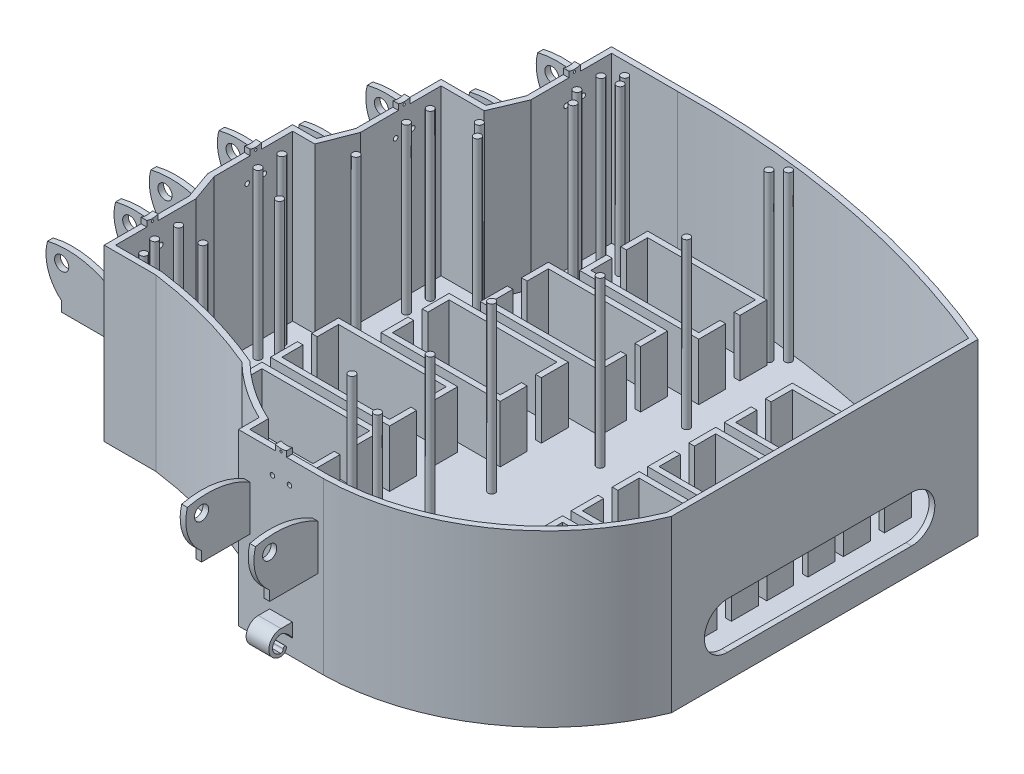
from build123d import *

# Parameters (mm, degrees)
BOSS_EXTRUDE1_DEPTH                = 38.1
CUT_EXTRUDE1_DEPTH                 = 36.83
BOSS_EXTRUDE2_DEPTH                = 13.97
BOSS_EXTRUDE3_DEPTH                = 13.97
BOSS_EXTRUDE4_DEPTH                = 13.97
BOSS_EXTRUDE5_DEPTH                = 13.97
BOSS_EXTRUDE6_DEPTH                = 13.97
BOSS_EXTRUDE7_DEPTH                = 13.97
BOSS_EXTRUDE8_DEPTH                = 13.97
BOSS_EXTRUDE9_DEPTH                = 13.97
BOSS_EXTRUDE10_DEPTH               = 13.97
BOSS_EXTRUDE11_DEPTH               = 13.97
SKETCH25_R                         = 0.508
THUMB_HOLES_DEPTH                  = 12.7
SKETCH31_R                         = 0.508
INDEX_FINGER_HOLES_DEPTH           = 17.018
SKETCH32_R                         = 0.508
MIDDLE_FINGER_HOLES_DEPTH          = 15.24
SKETCH33_R                         = 0.508
RING_FINGER_HOLES_DEPTH            = 22.86
SKETCH34_R                         = 0.508
PINKY_FINGER_HOLES_DEPTH           = 35.56
SKETCH26_R                         = 0.79375
GUIDE_POLES_DEPTH                  = 36.83
SKETCH35_R                         = 1.5875
PINKY_ATTACHMENT_DEPTH             = 19.05
SKETCH36_R                         = 1.5875
RING_ATTACHMENT_DEPTH              = 19.05
SKETCH37_R                         = 1.5875
MIDDLE_ATTACHMENT_DEPTH            = 19.05
SKETCH38_R                         = 1.5875
POINTER_ATTACHMENT_DEPTH           = 19.05
SKETCH39_R                         = 1.5875
THUMB_ATTACHMENT_DEPTH             = 19.05
ATTACHMENT_TRIM_DEPTH              = 25.4
CORD_HOLE_DEPTH                    = 5.08
SKETCH42_W                         = 1.27
SKETCH42_H                         = 2.54
SKETCH42_W_2                       = 2.54
SKETCH42_H_2                       = 1.27
LINE_CONNECTORS_ON_HAND_EDGE_DEPTH = 1.27
SKETCH43_R                         = 0.254
FINGER_LINE_CONNECTOR_CUT_DEPTH    = 50.8
SKETCH44_R                         = 0.254
THUMB_LINE_CONNECTOR_CUT_DEPTH     = 12.7
PINKY_HOOK_DEPTH                   = 19.05
SKETCH47_W                         = 5.527423295
SKETCH47_H                         = 7.099733724
PINKY_HOOK_CUT_1_DEPTH             = 19.05
RING_HOOK_DEPTH                    = 19.05
SKETCH53_W                         = 5.632789883
SKETCH53_H                         = 7.123488913
RING_HOOK_CUT_1_DEPTH              = 19.05
MIDDLE_HOOK_DEPTH                  = 19.05
MIDDLE_HOOK_2_DEPTH                = 19.05
SKETCH57_W                         = 6.44385504
SKETCH57_H                         = 7.30367128
MIDDLE_HOOK_CUT_1_DEPTH            = 19.05
POINTER_HOOK_DEPTH                 = 19.05
SKETCH60_W                         = 5.76253221
SKETCH60_H                         = 6.997945427
POINTER_HOOK_CUT_1_DEPTH           = 19.05
THUMB_HOOK_DEPTH                   = 19.05
SKETCH64_W                         = 5.967890502
SKETCH64_H                         = 7.075125102
THUMB_HOOK_CUT_1_DEPTH             = 19.05
SKETCH65_W                         = 7.179265415
SKETCH65_H                         = 6.121930472
SKETCH65_W_2                       = 6.985
SKETCH65_H_2                       = 5.903479726
SKETCH65_W_3                       = 5.256802475
SKETCH65_H_3                       = 6.985
SKETCH65_W_4                       = 5.256802476
SKETCH65_W_5                       = 5.561170092
CUT_EXTRUDE9_DEPTH                 = 13.97


with BuildPart() as part:
    # Sketch2 → Boss-Extrude1 (new body)
    with BuildSketch(Plane(origin=(0, 0, 0), x_dir=(1, 0, 0), z_dir=(0, 1, 0))):
        with BuildLine():
            Line((-20.778406205, 52.758673202), (-36.188953289, 52.758673202))
            Line((-36.188953289, 52.758673202), (-36.188953289, 33.708673202))
            Line((-36.188953289, 33.708673202), (-38.864171838, 27.358673202))
            Line((-38.864171838, 27.358673202), (-48.947687906, 27.358673202))
            Line((-48.947687906, 27.358673202), (-48.947687906, 8.308673202))
            Line((-48.947687906, 8.308673202), (-51.417120413, 1.958673202))
            Line((-51.417120413, 1.958673202), (-56.767557511, 1.958673202))
            Line((-56.767557511, 1.958673202), (-56.767557511, -17.091326798))
            Line((-56.767557511, -17.091326798), (-54.503911047, -23.441326798))
            Line((-54.503911047, -23.441326798), (-54.503911047, -42.491326798))
            Line((-54.503911047, -42.491326798), (-42.959403849, -42.491326798))
            ThreePointArc((-42.959403849, -42.491326798), (-29.448791922, -45.239401215), (-16.422067996, -49.755263412))
            ThreePointArc((-16.422067996, -49.755263412), (-10.441569813, -54.6928899), (-3.738179712, -58.593027718))
            Line((-3.738179712, -58.593027718), (-3.738179712, -63.210333869))
            Line((-3.738179712, -63.210333869), (15.311820288, -63.210333869))
            ThreePointArc((15.311820288, -63.210333869), (43.202331698, -54.363191859), (61.572422141, -31.588374066))
            Line((61.572422141, -31.588374066), (61.572422141, 37.055318004))
            ThreePointArc((61.572422141, 37.055318004), (21.220515188, 49.225595088), (-20.778406205, 52.758673202))
        make_face()
    extrude(amount=BOSS_EXTRUDE1_DEPTH)

    # Sketch3 → Cut-Extrude1 (cut)
    with BuildSketch(Plane(origin=(0, 38.1, 0), x_dir=(1, 0, 0), z_dir=(0, 1, 0))):
        with BuildLine():
            Line((-20.193208334, 51.499667825), (-34.918953289, 51.499667825))
            Line((-34.918953289, 51.499667825), (-34.918953289, 33.452072477))
            Line((-34.918953289, 33.452072477), (-38.021111135, 26.088673202))
            Line((-38.021111135, 26.088673202), (-47.677687906, 26.088673202))
            Line((-47.677687906, 26.088673202), (-47.677687906, 8.070420839))
            Line((-47.677687906, 8.070420839), (-50.548353666, 0.688673202))
            Line((-50.548353666, 0.688673202), (-55.497557511, 0.688673202))
            Line((-55.497557511, 0.688673202), (-55.497557511, -16.871730038))
            Line((-55.497557511, -16.871730038), (-53.233911047, -23.221730038))
            Line((-53.233911047, -23.221730038), (-53.233911047, -41.221326798))
            Line((-53.233911047, -41.221326798), (-42.874353316, -41.221326798))
            ThreePointArc((-42.874353316, -41.221326798), (-29.038510393, -44.035017068), (-15.705342229, -48.67980221))
            ThreePointArc((-15.705342229, -48.67980221), (-9.484723257, -53.810670952), (-2.468179712, -57.784338167))
            Line((-2.468179712, -57.784338167), (-2.468179712, -61.940333869))
            Line((-2.468179712, -61.940333869), (15.331165443, -61.940333869))
            ThreePointArc((15.331165443, -61.940333869), (42.399187632, -53.3742297), (60.302422141, -31.339480781))
            Line((60.302422141, -31.339480781), (60.302422141, 36.20914612))
            ThreePointArc((60.302422141, 36.20914612), (20.842965823, 48.004654395), (-20.193208334, 51.499667825))
        make_face()
    extrude(amount=-CUT_EXTRUDE1_DEPTH, mode=Mode.SUBTRACT)

    # Sketch6 → Boss-Extrude2 (add)
    with BuildSketch(Plane(origin=(0, 0, 0), x_dir=(1, 0, 0), z_dir=(0, 1, 0))):
        Polygon((-38.295888343, -32.597001669), (-37.025888343, -32.597001669), (-37.025888343, -37.359501669), (-12.895888343, -37.359501669), (-12.895888343, -32.597001669), (-11.625888343, -32.597001669), (-11.625888343, -38.629501669), (-38.295888343, -38.629501669), align=None)
        Polygon((-12.895888343, -24.659501669), (-37.025888343, -24.659501669), (-37.025888343, -29.422001669), (-38.295888343, -29.422001669), (-38.295888343, -23.389501669), (-11.625888343, -23.389501669), (-11.625888343, -29.422001669), (-12.895888343, -29.422001669), align=None)
    extrude(amount=BOSS_EXTRUDE2_DEPTH)

    # Sketch7 → Boss-Extrude3 (add)
    with BuildSketch(Plane(origin=(0, 0, 0), x_dir=(1, 0, 0), z_dir=(0, 1, 0))):
        Polygon((-38.295888343, -15.452001669), (-37.025888343, -15.452001669), (-37.025888343, -20.214501669), (-12.895888343, -20.214501669), (-12.895888343, -15.452001669), (-11.625888343, -15.452001669), (-11.625888343, -21.484501669), (-38.295888343, -21.484501669), align=None)
        Polygon((-12.895888343, -7.514501669), (-37.025888343, -7.514501669), (-37.025888343, -12.277001669), (-38.295888343, -12.277001669), (-38.295888343, -6.244501669), (-11.625888343, -6.244501669), (-11.625888343, -12.277001669), (-12.895888343, -12.277001669), align=None)
    extrude(amount=BOSS_EXTRUDE3_DEPTH)

    # Sketch15 → Boss-Extrude4 (add)
    with BuildSketch(Plane.XZ):
        Polygon((-30.675888343, -4.867998331), (-29.405888343, -4.867998331), (-29.405888343, -9.630498331), (-5.275888343, -9.630498331), (-5.275888343, -4.867998331), (-4.005888343, -4.867998331), (-4.005888343, -10.900498331), (-30.675888343, -10.900498331), align=None)
        Polygon((-5.275888343, 3.069501669), (-29.405888343, 3.069501669), (-29.405888343, -1.692998331), (-30.675888343, -1.692998331), (-30.675888343, 4.339501669), (-4.005888343, 4.339501669), (-4.005888343, -1.692998331), (-5.275888343, -1.692998331), align=None)
    extrude(amount=-BOSS_EXTRUDE4_DEPTH)

    # Sketch16 → Boss-Extrude5 (add)
    with BuildSketch(Plane.XZ):
        Polygon((-25.595888343, -22.012998331), (-24.325888343, -22.012998331), (-24.325888343, -26.775498331), (-0.195888343, -26.775498331), (-0.195888343, -22.012998331), (1.074111657, -22.012998331), (1.074111657, -28.045498331), (-25.595888343, -28.045498331), align=None)
        Polygon((-0.195888343, -14.075498331), (-24.325888343, -14.075498331), (-24.325888343, -18.837998331), (-25.595888343, -18.837998331), (-25.595888343, -12.805498331), (1.074111657, -12.805498331), (1.074111657, -18.837998331), (-0.195888343, -18.837998331), align=None)
    extrude(amount=-BOSS_EXTRUDE5_DEPTH)

    # Sketch17 → Boss-Extrude6 (add)
    with BuildSketch(Plane.XZ):
        Polygon((-20.515888343, -39.157998331), (-19.245888343, -39.157998331), (-19.245888343, -43.920498331), (4.884111657, -43.920498331), (4.884111657, -39.157998331), (6.154111657, -39.157998331), (6.154111657, -45.190498331), (-20.515888343, -45.190498331), align=None)
        Polygon((4.884111657, -31.220498331), (-19.245888343, -31.220498331), (-19.245888343, -35.982998331), (-20.515888343, -35.982998331), (-20.515888343, -29.950498331), (6.154111657, -29.950498331), (6.154111657, -35.982998331), (4.884111657, -35.982998331), align=None)
    extrude(amount=-BOSS_EXTRUDE6_DEPTH)

    # Sketch18 → Boss-Extrude7 (add)
    with BuildSketch(Plane.XZ):
        Polygon((14.980982224, 42.694916505), (16.250982224, 42.694916505), (16.250982224, 37.932416505), (40.380982224, 37.932416505), (40.380982224, 42.694916505), (41.650982224, 42.694916505), (41.650982224, 36.662416505), (14.980982224, 36.662416505), align=None)
        Polygon((40.380982224, 50.632416505), (16.250982224, 50.632416505), (16.250982224, 45.869916505), (14.980982224, 45.869916505), (14.980982224, 51.902416505), (41.650982224, 51.902416505), (41.650982224, 45.869916505), (40.380982224, 45.869916505), align=None)
    extrude(amount=-BOSS_EXTRUDE7_DEPTH)

    # Sketch19 → Boss-Extrude8 (add)
    with BuildSketch(Plane.XZ):
        Polygon((25.140982224, 25.549916505), (26.410982224, 25.549916505), (26.410982224, 20.787416505), (50.540982224, 20.787416505), (50.540982224, 25.549916505), (51.810982224, 25.549916505), (51.810982224, 19.517416505), (25.140982224, 19.517416505), align=None)
        Polygon((50.540982224, 33.487416505), (26.410982224, 33.487416505), (26.410982224, 28.724916505), (25.140982224, 28.724916505), (25.140982224, 34.757416505), (51.810982224, 34.757416505), (51.810982224, 28.724916505), (50.540982224, 28.724916505), align=None)
    extrude(amount=-BOSS_EXTRUDE8_DEPTH)

    # Sketch20 → Boss-Extrude9 (add)
    with BuildSketch(Plane.XZ):
        Polygon((25.140982224, 8.404916505), (26.410982224, 8.404916505), (26.410982224, 3.642416505), (50.540982224, 3.642416505), (50.540982224, 8.404916505), (51.810982224, 8.404916505), (51.810982224, 2.372416505), (25.140982224, 2.372416505), align=None)
        Polygon((50.540982224, 16.342416505), (26.410982224, 16.342416505), (26.410982224, 11.579916505), (25.140982224, 11.579916505), (25.140982224, 17.612416505), (51.810982224, 17.612416505), (51.810982224, 11.579916505), (50.540982224, 11.579916505), align=None)
    extrude(amount=-BOSS_EXTRUDE9_DEPTH)

    # Sketch21 → Boss-Extrude10 (add)
    with BuildSketch(Plane.XZ):
        Polygon((25.140982224, -8.740083495), (26.410982224, -8.740083495), (26.410982224, -13.502583495), (50.540982224, -13.502583495), (50.540982224, -8.740083495), (51.810982224, -8.740083495), (51.810982224, -14.772583495), (25.140982224, -14.772583495), align=None)
        Polygon((50.540982224, -0.802583495), (26.410982224, -0.802583495), (26.410982224, -5.565083495), (25.140982224, -5.565083495), (25.140982224, 0.467416505), (51.810982224, 0.467416505), (51.810982224, -5.565083495), (50.540982224, -5.565083495), align=None)
    extrude(amount=-BOSS_EXTRUDE10_DEPTH)

    # Sketch22 → Boss-Extrude11 (add)
    with BuildSketch(Plane.XZ):
        Polygon((25.140982224, -25.885083495), (26.410982224, -25.885083495), (26.410982224, -30.647583495), (50.540982224, -30.647583495), (50.540982224, -25.885083495), (51.810982224, -25.885083495), (51.810982224, -31.917583495), (25.140982224, -31.917583495), align=None)
        Polygon((50.540982224, -17.947583495), (26.410982224, -17.947583495), (26.410982224, -22.710083495), (25.140982224, -22.710083495), (25.140982224, -16.677583495), (51.810982224, -16.677583495), (51.810982224, -22.710083495), (50.540982224, -22.710083495), align=None)
    extrude(amount=-BOSS_EXTRUDE11_DEPTH)

    # Sketch25 → Thumb Holes (cut)
    with BuildSketch(Plane.XY.offset(63.5)):
        with Locations((7.691820288, 33.02)):
            Circle(SKETCH25_R)
        with Locations((3.881820288, 33.02)):
            Circle(SKETCH25_R)
    extrude(amount=-THUMB_HOLES_DEPTH, mode=Mode.SUBTRACT)

    # Sketch31 → Index Finger Holes (cut)
    with BuildSketch(Plane(origin=(-69.85, 0, 0), x_dir=(0, 0, -1), z_dir=(1, 0, 0))):
        with Locations((-31.061326798, 33.02)):
            Circle(SKETCH31_R)
        with Locations((-34.871326798, 33.02)):
            Circle(SKETCH31_R)
    extrude(amount=INDEX_FINGER_HOLES_DEPTH, mode=Mode.SUBTRACT)

    # Sketch32 → Middle Finger Holes (cut)
    with BuildSketch(Plane(origin=(-69.85, 0, 0), x_dir=(0, 0, -1), z_dir=(1, 0, 0))):
        with Locations((-9.471326798, 33.02)):
            Circle(SKETCH32_R)
        with Locations((-5.661326798, 33.02)):
            Circle(SKETCH32_R)
    extrude(amount=MIDDLE_FINGER_HOLES_DEPTH, mode=Mode.SUBTRACT)

    # Sketch33 → Ring Finger Holes (cut)
    with BuildSketch(Plane(origin=(-69.85, 0, 0), x_dir=(0, 0, -1), z_dir=(1, 0, 0))):
        with Locations((15.928673202, 33.02)):
            Circle(SKETCH33_R)
        with Locations((19.738673202, 33.02)):
            Circle(SKETCH33_R)
    extrude(amount=RING_FINGER_HOLES_DEPTH, mode=Mode.SUBTRACT)

    # Sketch34 → Pinky Finger Holes (cut)
    with BuildSketch(Plane(origin=(-69.85, 0, 0), x_dir=(0, 0, -1), z_dir=(1, 0, 0))):
        with Locations((41.328673202, 33.02)):
            Circle(SKETCH34_R)
        with Locations((45.181435651, 33.02)):
            Circle(SKETCH34_R)
    extrude(amount=PINKY_FINGER_HOLES_DEPTH, mode=Mode.SUBTRACT)

    # Sketch26 → Guide Poles (add)
    with BuildSketch(Plane(origin=(0, 38.1, 0), x_dir=(1, 0, 0), z_dir=(0, 1, 0))):
        with Locations((8.453820288, -44.282416505)):
            Circle(SKETCH26_R)
        with Locations((3.119820288, -27.137416505)):
            Circle(SKETCH26_R)
        with Locations((-0.26286752, -9.992416505)):
            Circle(SKETCH26_R)
        with Locations((6.891203923, 7.152583495)):
            Circle(SKETCH26_R)
        with Locations((9.098692406, 24.297583495)):
            Circle(SKETCH26_R)
        with Locations((-1.85036752, -39.675840032)):
            Circle(SKETCH26_R)
        with Locations((7.511192406, 48.675794749)):
            Circle(SKETCH26_R)
        with Locations((5.303703923, 46.519643207)):
            Circle(SKETCH26_R)
        with Locations((-48.471411047, -39.675840032)):
            Circle(SKETCH26_R)
        with Locations((-52.322557511, -10.233326798)):
            Circle(SKETCH26_R)
        with Locations((-52.322557511, -4.899326798)):
            Circle(SKETCH26_R)
        with Locations((-43.893096038, -13.864501669)):
            Circle(SKETCH26_R)
        with Locations((-43.893096038, 3.280498331)):
            Circle(SKETCH26_R)
        with Locations((-33.874140009, 20.425498331)):
            Circle(SKETCH26_R)
        with Locations((-44.502687906, 15.166673202)):
            Circle(SKETCH26_R)
        with Locations((-29.603786365, 37.570498331)):
            Circle(SKETCH26_R)
        with Locations((-36.306573109, 23.2953928)):
            Circle(SKETCH26_R)
        with Locations((-44.502687906, 20.500673202)):
            Circle(SKETCH26_R)
        with Locations((-28.009949736, 46.519643207)):
            Circle(SKETCH26_R)
        with Locations((-29.153323684, 48.675794749)):
            Circle(SKETCH26_R)
        with Locations((-31.743953289, 40.566673202)):
            Circle(SKETCH26_R)
        with Locations((-31.743953289, 45.943435651)):
            Circle(SKETCH26_R)
        with Locations((-50.058911047, -35.633326798)):
            Circle(SKETCH26_R)
        with Locations((-50.058911047, -30.299326798)):
            Circle(SKETCH26_R)
        with Locations((-43.893096038, -31.009501669)):
            Circle(SKETCH26_R)
    extrude(amount=-GUIDE_POLES_DEPTH)

    # Sketch35 → Pinky Attachment (add)
    with BuildSketch(Plane(origin=(0, 0, -52.758673202), x_dir=(-1, 0, 0), z_dir=(0, 0, -1))):
        with BuildLine():
            Line((36.188953289, 19.05), (40.633953289, 19.05))
            Line((40.633953289, 19.05), (46.983953289, 19.05))
            Line((46.983953289, 19.05), (46.983953289, 21.249207691))
            ThreePointArc((46.983953289, 21.249207691), (50.046648442, 25.776891551), (50.158953289, 31.242))
            ThreePointArc((50.158953289, 31.242), (42.978780551, 31.567812574), (36.188953289, 29.21))
            Line((36.188953289, 29.21), (36.188953289, 19.05))
        make_face()
        with Locations((46.983953289, 28.575)):
            Circle(SKETCH35_R, mode=Mode.SUBTRACT)
    extrude(amount=-PINKY_ATTACHMENT_DEPTH)

    # Sketch36 → Ring Attachment (add)
    with BuildSketch(Plane(origin=(0, 0, -27.358673202), x_dir=(-1, 0, 0), z_dir=(0, 0, -1))):
        with BuildLine():
            Line((48.947687906, 29.21), (48.947687906, 19.05))
            Line((48.947687906, 19.05), (53.392687906, 19.05))
            Line((53.392687906, 19.05), (59.742687906, 19.05))
            Line((59.742687906, 19.05), (59.742687906, 21.249207691))
            ThreePointArc((59.742687906, 21.249207691), (62.80538306, 25.776891551), (62.917687906, 31.242))
            ThreePointArc((62.917687906, 31.242), (55.737515168, 31.567812574), (48.947687906, 29.21))
        make_face()
        with Locations((59.742687906, 28.707395517)):
            Circle(SKETCH36_R, mode=Mode.SUBTRACT)
    extrude(amount=-RING_ATTACHMENT_DEPTH)

    # Sketch37 → Middle Attachment (add)
    with BuildSketch(Plane(origin=(0, 0, -1.958673202), x_dir=(-1, 0, 0), z_dir=(0, 0, -1))):
        with BuildLine():
            Line((56.767557511, 29.21), (56.767557511, 19.05))
            Line((56.767557511, 19.05), (61.212557511, 19.05))
            Line((61.212557511, 19.05), (67.562557511, 19.05))
            Line((67.562557511, 19.05), (67.562557511, 21.249207691))
            ThreePointArc((67.562557511, 21.249207691), (70.625252665, 25.776891551), (70.737557511, 31.242))
            ThreePointArc((70.737557511, 31.242), (63.557384773, 31.567812574), (56.767557511, 29.21))
        make_face()
        with Locations((67.562557511, 28.575)):
            Circle(SKETCH37_R, mode=Mode.SUBTRACT)
    extrude(amount=-MIDDLE_ATTACHMENT_DEPTH)

    # Sketch38 → Pointer Attachment (add)
    with BuildSketch(Plane(origin=(0, 0, 23.441326798), x_dir=(-1, 0, 0), z_dir=(0, 0, -1))):
        with BuildLine():
            Line((54.503911047, 29.21), (54.503911047, 19.05))
            Line((54.503911047, 19.05), (65.298911047, 19.05))
            Line((65.298911047, 19.05), (65.298911047, 21.249207691))
            ThreePointArc((65.298911047, 21.249207691), (68.3616062, 25.776891551), (68.473911047, 31.242))
            ThreePointArc((68.473911047, 31.242), (61.293738309, 31.567812574), (54.503911047, 29.21))
        make_face()
        with Locations((65.298911047, 28.575)):
            Circle(SKETCH38_R, mode=Mode.SUBTRACT)
    extrude(amount=-POINTER_ATTACHMENT_DEPTH)

    # Sketch39 → Thumb Attachment (add)
    with BuildSketch(Plane.ZY.offset(3.738179712)):
        with BuildLine():
            Line((63.210333869, 19.05), (67.655333869, 19.05))
            Line((67.655333869, 19.05), (74.005333869, 19.05))
            Line((74.005333869, 19.05), (74.005333869, 21.249207691))
            ThreePointArc((74.005333869, 21.249207691), (77.068029022, 25.776891551), (77.180333869, 31.242))
            ThreePointArc((77.180333869, 31.242), (70.000161131, 31.567812574), (63.210333869, 29.21))
            Line((63.210333869, 29.21), (63.210333869, 19.05))
        make_face()
        with Locations((74.005333869, 28.575)):
            Circle(SKETCH39_R, mode=Mode.SUBTRACT)
    extrude(amount=-THUMB_ATTACHMENT_DEPTH)

    # Sketch40 → Attachment Trim (cut)
    with BuildSketch(Plane(origin=(0, 38.1, 0), x_dir=(1, 0, 0), z_dir=(0, 1, 0))):
        with BuildLine():
            Line((-1.198179712, -63.210333869), (12.771820288, -63.210333869))
            Line((12.771820288, -63.210333869), (12.771820288, -78.53587148))
            Line((12.771820288, -78.53587148), (14.041820288, -78.53587148))
            Line((14.041820288, -78.53587148), (14.041820288, -63.210333869))
            Line((14.041820288, -63.210333869), (15.311820288, -63.210333869))
            ThreePointArc((15.311820288, -63.210333869), (4.445704746, -84.821396352), (-6.420410797, -63.210333869))
            Line((-6.420410797, -63.210333869), (-2.468179712, -63.210333869))
            Line((-2.468179712, -63.210333869), (-2.468179712, -78.478629921))
            Line((-2.468179712, -78.478629921), (-1.198179712, -78.478629921))
            Line((-1.198179712, -78.478629921), (-1.198179712, -63.210333869))
        make_face()
        with BuildLine():
            Line((-54.503911047, -42.491326798), (-54.503911047, -41.221326798))
            Line((-54.503911047, -41.221326798), (-69.450746427, -41.221326798))
            Line((-69.450746427, -41.221326798), (-69.450746427, -39.951326798))
            Line((-69.450746427, -39.951326798), (-54.503911047, -39.951326798))
            Line((-54.503911047, -39.951326798), (-54.503911047, -25.981326798))
            Line((-54.503911047, -25.981326798), (-69.522821924, -25.981326798))
            Line((-69.522821924, -25.981326798), (-69.522821924, -24.711326798))
            Line((-69.522821924, -24.711326798), (-54.503911047, -24.711326798))
            Line((-54.503911047, -24.711326798), (-54.503911047, -23.441326798))
            ThreePointArc((-54.503911047, -23.441326798), (-74.827366982, -32.966326798), (-54.503911047, -42.491326798))
        make_face()
        with BuildLine():
            Line((-56.767557511, -17.091326798), (-56.767557511, -15.821326798))
            Line((-56.767557511, -15.821326798), (-71.425044096, -15.821326798))
            Line((-71.425044096, -15.821326798), (-71.425044096, -14.551326798))
            Line((-71.425044096, -14.551326798), (-56.767557511, -14.551326798))
            Line((-56.767557511, -14.551326798), (-56.767557511, -0.581326798))
            Line((-56.767557511, -0.581326798), (-71.300395146, -0.581326798))
            Line((-71.300395146, -0.581326798), (-71.300395146, 0.688673202))
            Line((-71.300395146, 0.688673202), (-56.767557511, 0.688673202))
            Line((-56.767557511, 0.688673202), (-56.767557511, 1.958673202))
            ThreePointArc((-56.767557511, 1.958673202), (-78.393851178, -7.566326798), (-56.767557511, -17.091326798))
        make_face()
        with BuildLine():
            Line((-48.947687906, 8.308673202), (-48.947687906, 9.578673202))
            Line((-48.947687906, 9.578673202), (-63.81659846, 9.578673202))
            Line((-63.81659846, 9.578673202), (-63.81659846, 10.848673202))
            Line((-63.81659846, 10.848673202), (-48.947687906, 10.848673202))
            Line((-48.947687906, 10.848673202), (-48.947687906, 24.818673202))
            Line((-48.947687906, 24.818673202), (-63.871264763, 24.818673202))
            Line((-63.871264763, 24.818673202), (-63.871264763, 26.088673202))
            Line((-63.871264763, 26.088673202), (-48.947687906, 26.088673202))
            Line((-48.947687906, 26.088673202), (-48.947687906, 27.358673202))
            ThreePointArc((-48.947687906, 27.358673202), (-69.447688873, 17.833673202), (-48.947687906, 8.308673202))
        make_face()
        with BuildLine():
            Line((-36.188953289, 33.708673202), (-36.188953289, 34.978673202))
            Line((-36.188953289, 34.978673202), (-51.878710413, 34.978673202))
            Line((-51.878710413, 34.978673202), (-51.878710413, 36.248673202))
            Line((-51.878710413, 36.248673202), (-36.188953289, 36.248673202))
            Line((-36.188953289, 36.248673202), (-36.188953289, 50.218673202))
            Line((-36.188953289, 50.218673202), (-51.739164497, 50.218673202))
            Line((-51.739164497, 50.218673202), (-51.739164497, 51.488673202))
            Line((-51.739164497, 51.488673202), (-36.188953289, 51.488673202))
            Line((-36.188953289, 51.488673202), (-36.188953289, 52.758673202))
            ThreePointArc((-36.188953289, 52.758673202), (-55.79651108, 43.233673202), (-36.188953289, 33.708673202))
        make_face()
    extrude(amount=-ATTACHMENT_TRIM_DEPTH, mode=Mode.SUBTRACT)

    # Sketch41 → Cord Hole (cut)
    with BuildSketch(Plane(origin=(62.913848002, 0, 0), x_dir=(0, 0, -1), z_dir=(1, 0, 0))):
        with BuildLine():
            Line((-19.01291879, 15.851932983), (22.200875308, 15.851932983))
            ThreePointArc((22.200875308, 15.851932983), (27.393164329, 10.659643963), (22.200875308, 5.467354942))
            Line((22.200875308, 5.467354942), (-19.01291879, 5.467354942))
            ThreePointArc((-19.01291879, 5.467354942), (-24.20520781, 10.659643963), (-19.01291879, 15.851932983))
        make_face()
    extrude(amount=-CORD_HOLE_DEPTH, mode=Mode.SUBTRACT)

    # Sketch42 → Line Connectors on Hand Edge (add)
    with BuildSketch(Plane(origin=(0, 38.1, 0), x_dir=(1, 0, 0), z_dir=(0, 1, 0))):
        with Locations((-35.553953289, 43.233673202)):
            Rectangle(SKETCH42_W, SKETCH42_H)
        with Locations((-48.312687906, 17.833673202)):
            Rectangle(SKETCH42_W, SKETCH42_H)
        with Locations((-56.132557511, -7.566326798)):
            Rectangle(SKETCH42_W, SKETCH42_H)
        with Locations((-53.868911047, -32.966326798)):
            Rectangle(SKETCH42_W, SKETCH42_H)
        with Locations((5.786820288, -62.575333869)):
            Rectangle(SKETCH42_W_2, SKETCH42_H_2)
    extrude(amount=LINE_CONNECTORS_ON_HAND_EDGE_DEPTH)

    # Sketch43 → Finger Line Connector Cut (cut)
    with BuildSketch(Plane(origin=(-69.85, 0, 0), x_dir=(0, 0, -1), z_dir=(1, 0, 0))):
        with Locations((-32.966326798, 38.608)):
            Circle(SKETCH43_R)
        with Locations((-7.566326798, 38.608)):
            Circle(SKETCH43_R)
        with Locations((17.833673202, 38.608)):
            Circle(SKETCH43_R)
        with Locations((43.233673202, 38.608)):
            Circle(SKETCH43_R)
        with BuildLine():
            ThreePointArc((-34.236326798, 39.37), (-32.966326798, 39.152102448), (-31.696326798, 39.37))
            ThreePointArc((-31.696326798, 39.37), (-32.966326798, 39.746489645), (-34.236326798, 39.37))
        make_face()
        with BuildLine():
            ThreePointArc((-8.836326798, 39.37), (-7.566326798, 39.152102448), (-6.296326798, 39.37))
            ThreePointArc((-6.296326798, 39.37), (-7.566326798, 39.786489071), (-8.836326798, 39.37))
        make_face()
        with BuildLine():
            ThreePointArc((16.563673202, 39.37), (17.833673202, 39.152102448), (19.103673202, 39.37))
            ThreePointArc((19.103673202, 39.37), (17.833673202, 39.896051224), (16.563673202, 39.37))
        make_face()
        with BuildLine():
            ThreePointArc((41.963673202, 39.37), (43.233673202, 39.152102448), (44.503673202, 39.37))
            ThreePointArc((44.503673202, 39.37), (43.233673202, 39.679166891), (41.963673202, 39.37))
        make_face()
    extrude(amount=FINGER_LINE_CONNECTOR_CUT_DEPTH, mode=Mode.SUBTRACT)

    # Sketch44 → Thumb Line Connector Cut (cut)
    with BuildSketch(Plane.XY.offset(63.5)):
        with Locations((5.786820288, 38.608)):
            Circle(SKETCH44_R)
        with BuildLine():
            ThreePointArc((7.056820288, 39.37), (5.786820288, 39.152102448), (4.516820288, 39.37))
            ThreePointArc((4.516820288, 39.37), (5.786820288, 39.896051224), (7.056820288, 39.37))
        make_face()
    extrude(amount=-THUMB_LINE_CONNECTOR_CUT_DEPTH, mode=Mode.SUBTRACT)

    # Sketch46 → Pinky Hook (add)
    with BuildSketch(Plane(origin=(0, 0, -52.758673202), x_dir=(-1, 0, 0), z_dir=(0, 0, -1))):
        with BuildLine():
            Line((38.728953289, 8.89), (36.188953289, 8.89))
            Line((36.188953289, 8.89), (36.188953289, 12.007013633))
            ThreePointArc((36.188953289, 12.007013633), (37.253888001, 10.713868099), (38.728953289, 9.919831756))
            ThreePointArc((38.728953289, 9.919831756), (40.011077208, 10.520271405), (40.650106055, 11.783604952))
            ThreePointArc((40.650106055, 11.783604952), (40.045282722, 13.07409489), (38.764186085, 13.69856823))
            ThreePointArc((38.764186085, 13.69856823), (38.378904743, 13.481176717), (38.223605208, 13.066951131))
            ThreePointArc((38.223605208, 13.066951131), (37.883185134, 12.706641867), (37.522875871, 13.047061941))
            ThreePointArc((37.522875871, 13.047061941), (37.861533866, 13.935120258), (38.728953289, 14.323604952))
            ThreePointArc((38.728953289, 14.323604952), (40.650022742, 13.52787193), (41.445755764, 11.606802476))
            ThreePointArc((41.445755764, 11.606802476), (40.650022742, 9.685733022), (38.728953289, 8.89))
        make_face()
        with BuildLine():
            Line((38.728953289, 6.798773562), (36.188953289, 6.798773562))
            Line((36.188953289, 6.798773562), (36.188953289, 3.681759929))
            ThreePointArc((36.188953289, 3.681759929), (37.253888001, 4.974905464), (38.728953289, 5.768941806))
            ThreePointArc((38.728953289, 5.768941806), (40.011077208, 5.168502157), (40.650106055, 3.905168611))
            ThreePointArc((40.650106055, 3.905168611), (40.045282722, 2.614678673), (38.764186085, 1.990205333))
            ThreePointArc((38.764186085, 1.990205333), (38.378904743, 2.207596845), (38.223605208, 2.621822432))
            ThreePointArc((38.223605208, 2.621822432), (37.883185134, 2.982131695), (37.522875871, 2.641711621))
            ThreePointArc((37.522875871, 2.641711621), (37.861533866, 1.753653304), (38.728953289, 1.365168611))
            ThreePointArc((38.728953289, 1.365168611), (40.650022742, 2.160901633), (41.445755764, 4.081971086))
            ThreePointArc((41.445755764, 4.081971086), (40.650022742, 6.00304054), (38.728953289, 6.798773562))
        make_face()
    extrude(amount=-PINKY_HOOK_DEPTH)

    # Sketch47 → Pinky Hook Cut 1 (cut)
    with BuildSketch(Plane(origin=(0, 0, -52.758673202), x_dir=(-1, 0, 0), z_dir=(0, 0, -1))):
        with Locations((38.952664936, 12.322077186)):
            Rectangle(SKETCH47_W, SKETCH47_H)
    extrude(amount=-PINKY_HOOK_CUT_1_DEPTH, mode=Mode.SUBTRACT)

    # Sketch52 → Ring Hook (add)
    with BuildSketch(Plane(origin=(0, 0, -27.358673202), x_dir=(-1, 0, 0), z_dir=(0, 0, -1))):
        with BuildLine():
            Line((51.487687906, 8.89), (48.947687906, 8.89))
            Line((48.947687906, 8.89), (48.947687906, 12.007013633))
            ThreePointArc((48.947687906, 12.007013633), (50.012622619, 10.713868099), (51.487687906, 9.919831756))
            ThreePointArc((51.487687906, 9.919831756), (52.769811826, 10.520271405), (53.408840673, 11.783604952))
            ThreePointArc((53.408840673, 11.783604952), (52.80401734, 13.07409489), (51.522920703, 13.69856823))
            ThreePointArc((51.522920703, 13.69856823), (51.13763936, 13.481176717), (50.982339826, 13.066951131))
            ThreePointArc((50.982339826, 13.066951131), (50.641919752, 12.706641867), (50.281610489, 13.047061941))
            ThreePointArc((50.281610489, 13.047061941), (50.620268484, 13.935120258), (51.487687906, 14.323604952))
            ThreePointArc((51.487687906, 14.323604952), (53.40875736, 13.52787193), (54.204490382, 11.606802476))
            ThreePointArc((54.204490382, 11.606802476), (53.40875736, 9.685733022), (51.487687906, 8.89))
        make_face()
        with BuildLine():
            Line((51.487687906, 6.798773562), (48.947687906, 6.798773562))
            Line((48.947687906, 6.798773562), (48.947687906, 3.681759929))
            ThreePointArc((48.947687906, 3.681759929), (50.012622619, 4.974905464), (51.487687906, 5.768941806))
            ThreePointArc((51.487687906, 5.768941806), (52.769811826, 5.168502157), (53.408840673, 3.905168611))
            ThreePointArc((53.408840673, 3.905168611), (52.80401734, 2.614678673), (51.522920703, 1.990205333))
            ThreePointArc((51.522920703, 1.990205333), (51.13763936, 2.207596845), (50.982339826, 2.621822432))
            ThreePointArc((50.982339826, 2.621822432), (50.641919752, 2.982131695), (50.281610489, 2.641711621))
            ThreePointArc((50.281610489, 2.641711621), (50.620268484, 1.753653304), (51.487687906, 1.365168611))
            ThreePointArc((51.487687906, 1.365168611), (53.40875736, 2.160901633), (54.204490382, 4.081971086))
            ThreePointArc((54.204490382, 4.081971086), (53.40875736, 6.00304054), (51.487687906, 6.798773562))
        make_face()
    extrude(amount=-RING_HOOK_DEPTH)

    # Sketch53 → Ring Hook Cut 1 (cut)
    with BuildSketch(Plane(origin=(0, 0, -27.358673202), x_dir=(-1, 0, 0), z_dir=(0, 0, -1))):
        with Locations((51.764082848, 11.948421999)):
            Rectangle(SKETCH53_W, SKETCH53_H)
    extrude(amount=-RING_HOOK_CUT_1_DEPTH, mode=Mode.SUBTRACT)

    # Sketch59 → Pointer Hook (add)
    with BuildSketch(Plane(origin=(0, 0, 23.441326798), x_dir=(-1, 0, 0), z_dir=(0, 0, -1))):
        with BuildLine():
            Line((57.043911047, 8.89), (54.503911047, 8.89))
            Line((54.503911047, 8.89), (54.503911047, 12.007013633))
            ThreePointArc((54.503911047, 12.007013633), (55.568845759, 10.713868099), (57.043911047, 9.919831756))
            ThreePointArc((57.043911047, 9.919831756), (58.326034966, 10.520271405), (58.965063813, 11.783604952))
            ThreePointArc((58.965063813, 11.783604952), (58.36024048, 13.07409489), (57.079143843, 13.69856823))
            ThreePointArc((57.079143843, 13.69856823), (56.693862501, 13.481176717), (56.538562966, 13.066951131))
            ThreePointArc((56.538562966, 13.066951131), (56.198142892, 12.706641867), (55.837833629, 13.047061941))
            ThreePointArc((55.837833629, 13.047061941), (56.176491624, 13.935120258), (57.043911047, 14.323604952))
            ThreePointArc((57.043911047, 14.323604952), (58.9649805, 13.52787193), (59.760713522, 11.606802476))
            ThreePointArc((59.760713522, 11.606802476), (58.9649805, 9.685733022), (57.043911047, 8.89))
        make_face()
        with BuildLine():
            Line((57.043911047, 6.798773562), (54.503911047, 6.798773562))
            Line((54.503911047, 6.798773562), (54.503911047, 3.681759929))
            ThreePointArc((54.503911047, 3.681759929), (55.568845759, 4.974905464), (57.043911047, 5.768941806))
            ThreePointArc((57.043911047, 5.768941806), (58.326034966, 5.168502157), (58.965063813, 3.905168611))
            ThreePointArc((58.965063813, 3.905168611), (58.36024048, 2.614678673), (57.079143843, 1.990205333))
            ThreePointArc((57.079143843, 1.990205333), (56.693862501, 2.207596845), (56.538562966, 2.621822432))
            ThreePointArc((56.538562966, 2.621822432), (56.198142892, 2.982131695), (55.837833629, 2.641711621))
            ThreePointArc((55.837833629, 2.641711621), (56.176491624, 1.753653304), (57.043911047, 1.365168611))
            ThreePointArc((57.043911047, 1.365168611), (58.9649805, 2.160901633), (59.760713522, 4.081971086))
            ThreePointArc((59.760713522, 4.081971086), (58.9649805, 6.00304054), (57.043911047, 6.798773562))
        make_face()
    extrude(amount=-POINTER_HOOK_DEPTH)

    # Sketch60 → Pointer Hook Cut 1 (cut)
    with BuildSketch(Plane(origin=(0, 0, 23.441326798), x_dir=(-1, 0, 0), z_dir=(0, 0, -1))):
        with Locations((57.385177152, 11.759931593)):
            Rectangle(SKETCH60_W, SKETCH60_H)
    extrude(amount=-POINTER_HOOK_CUT_1_DEPTH, mode=Mode.SUBTRACT)

    # Sketch63 → Thumb Hook (add)
    with BuildSketch(Plane.ZY.offset(3.738179712)):
        with BuildLine():
            Line((65.750333869, 8.89), (63.210333869, 8.89))
            Line((63.210333869, 8.89), (63.210333869, 12.007013633))
            ThreePointArc((63.210333869, 12.007013633), (64.275268581, 10.713868099), (65.750333869, 9.919831756))
            ThreePointArc((65.750333869, 9.919831756), (67.032457789, 10.520271405), (67.671486635, 11.783604952))
            ThreePointArc((67.671486635, 11.783604952), (67.066663302, 13.07409489), (65.785566665, 13.69856823))
            ThreePointArc((65.785566665, 13.69856823), (65.400285323, 13.481176717), (65.244985788, 13.066951131))
            ThreePointArc((65.244985788, 13.066951131), (64.904565714, 12.706641867), (64.544256451, 13.047061941))
            ThreePointArc((64.544256451, 13.047061941), (64.882914446, 13.935120258), (65.750333869, 14.323604952))
            ThreePointArc((65.750333869, 14.323604952), (67.671403323, 13.52787193), (68.467136345, 11.606802476))
            ThreePointArc((68.467136345, 11.606802476), (67.671403323, 9.685733022), (65.750333869, 8.89))
        make_face()
        with BuildLine():
            Line((65.750333869, 6.798773562), (63.210333869, 6.798773562))
            Line((63.210333869, 6.798773562), (63.210333869, 3.681759929))
            ThreePointArc((63.210333869, 3.681759929), (64.275268581, 4.974905464), (65.750333869, 5.768941806))
            ThreePointArc((65.750333869, 5.768941806), (67.032457789, 5.168502157), (67.671486635, 3.905168611))
            ThreePointArc((67.671486635, 3.905168611), (67.066663302, 2.614678673), (65.785566665, 1.990205333))
            ThreePointArc((65.785566665, 1.990205333), (65.400285323, 2.207596845), (65.244985788, 2.621822432))
            ThreePointArc((65.244985788, 2.621822432), (64.904565714, 2.982131695), (64.544256451, 2.641711621))
            ThreePointArc((64.544256451, 2.641711621), (64.882914446, 1.753653304), (65.750333869, 1.365168611))
            ThreePointArc((65.750333869, 1.365168611), (67.671403323, 2.160901633), (68.467136345, 4.081971086))
            ThreePointArc((68.467136345, 4.081971086), (67.671403323, 6.00304054), (65.750333869, 6.798773562))
        make_face()
    extrude(amount=-THUMB_HOOK_DEPTH)

    # Sketch64 → Thumb Hook Cut 1 (cut)
    with BuildSketch(Plane.ZY.offset(3.738179712)):
        with Locations((66.19427912, 11.933173705)):
            Rectangle(SKETCH64_W, SKETCH64_H)
    extrude(amount=-THUMB_HOOK_CUT_1_DEPTH, mode=Mode.SUBTRACT)


with BuildPart() as body_2:
    # Sketch56 → Middle Hook (new body)
    with BuildSketch(Plane(origin=(0, 0, -1.958673202), x_dir=(-1, 0, 0), z_dir=(0, 0, -1))):
        with BuildLine():
            Line((59.307557511, 8.89), (56.767557511, 8.89))
            Line((56.767557511, 8.89), (56.767557511, 12.007013633))
            ThreePointArc((56.767557511, 12.007013633), (57.832492224, 10.713868099), (59.307557511, 9.919831756))
            ThreePointArc((59.307557511, 9.919831756), (60.589681431, 10.520271405), (61.228710278, 11.783604952))
            ThreePointArc((61.228710278, 11.783604952), (60.623886944, 13.07409489), (59.342790307, 13.69856823))
            ThreePointArc((59.342790307, 13.69856823), (58.957508965, 13.481176717), (58.80220943, 13.066951131))
            ThreePointArc((58.80220943, 13.066951131), (58.461789356, 12.706641867), (58.101480093, 13.047061941))
            ThreePointArc((58.101480093, 13.047061941), (58.440138088, 13.935120258), (59.307557511, 14.323604952))
            ThreePointArc((59.307557511, 14.323604952), (61.228626965, 13.52787193), (62.024359987, 11.606802476))
            ThreePointArc((62.024359987, 11.606802476), (61.228626965, 9.685733022), (59.307557511, 8.89))
        make_face()
    extrude(amount=-MIDDLE_HOOK_DEPTH)

    # Sketch57 → Middle Hook Cut 1 (cut)
    with BuildSketch(Plane(origin=(0, 0, -1.958673202), x_dir=(-1, 0, 0), z_dir=(0, 0, -1))):
        with Locations((59.989485031, 11.404925675)):
            Rectangle(SKETCH57_W, SKETCH57_H)
    extrude(amount=-MIDDLE_HOOK_CUT_1_DEPTH, mode=Mode.SUBTRACT)


with BuildPart() as body_3:
    # Sketch56 → Middle Hook 2 (new body)
    with BuildSketch(Plane(origin=(0, 0, -1.958673202), x_dir=(-1, 0, 0), z_dir=(0, 0, -1))):
        with BuildLine():
            Line((59.307557511, 6.798773562), (56.767557511, 6.798773562))
            Line((56.767557511, 6.798773562), (56.767557511, 3.681759929))
            ThreePointArc((56.767557511, 3.681759929), (57.832492224, 4.974905464), (59.307557511, 5.768941806))
            ThreePointArc((59.307557511, 5.768941806), (60.589681431, 5.168502157), (61.228710278, 3.905168611))
            ThreePointArc((61.228710278, 3.905168611), (60.623886944, 2.614678673), (59.342790307, 1.990205333))
            ThreePointArc((59.342790307, 1.990205333), (58.957508965, 2.207596845), (58.80220943, 2.621822432))
            ThreePointArc((58.80220943, 2.621822432), (58.461789356, 2.982131695), (58.101480093, 2.641711621))
            ThreePointArc((58.101480093, 2.641711621), (58.440138088, 1.753653304), (59.307557511, 1.365168611))
            ThreePointArc((59.307557511, 1.365168611), (61.228626965, 2.160901633), (62.024359987, 4.081971086))
            ThreePointArc((62.024359987, 4.081971086), (61.228626965, 6.00304054), (59.307557511, 6.798773562))
        make_face()
    extrude(amount=-MIDDLE_HOOK_2_DEPTH)


with BuildPart() as cut_extrude9_tool:
    # Sketch65 → Cut-Extrude9 (new body)
    with BuildSketch(Plane(origin=(0, 0, 0), x_dir=(1, 0, 0), z_dir=(0, 1, 0))):
        with Locations((-0.342812419, -66.271299105)):
            Rectangle(SKETCH65_W, SKETCH65_H)
        with Locations((11.819320288, -66.162073732)):
            Rectangle(SKETCH65_W_2, SKETCH65_H_2)
        with Locations((-57.132312285, -38.998826798)):
            Rectangle(SKETCH65_W_3, SKETCH65_H_3)
        with Locations((-57.132312285, -26.933826798)):
            Rectangle(SKETCH65_W_3, SKETCH65_H_3)
        with Locations((-59.395958749, -1.533826798)):
            Rectangle(SKETCH65_W_4, SKETCH65_H_3)
        with Locations((-59.395958749, -13.598826798)):
            Rectangle(SKETCH65_W_4, SKETCH65_H_3)
        with Locations((-51.576089144, 23.866173202)):
            Rectangle(SKETCH65_W_4, SKETCH65_H_3)
        with Locations((-51.576089144, 11.801173202)):
            Rectangle(SKETCH65_W_4, SKETCH65_H_3)
        with Locations((-38.817354527, 49.266173202)):
            Rectangle(SKETCH65_W_3, SKETCH65_H_3)
        with Locations((-38.969538335, 37.201173202)):
            Rectangle(SKETCH65_W_5, SKETCH65_H_3)
    extrude(amount=CUT_EXTRUDE9_DEPTH)


with BuildPart() as part_1:
    add(part.part)

    # Cut-Extrude9: cut by cut_extrude9_tool
    add(cut_extrude9_tool.part, mode=Mode.SUBTRACT)


with BuildPart() as body_3_1:
    add(body_3.part)

    # Cut-Extrude9: cut by cut_extrude9_tool
    add(cut_extrude9_tool.part, mode=Mode.SUBTRACT)


solid = Compound([part_1.part, body_3_1.part])
